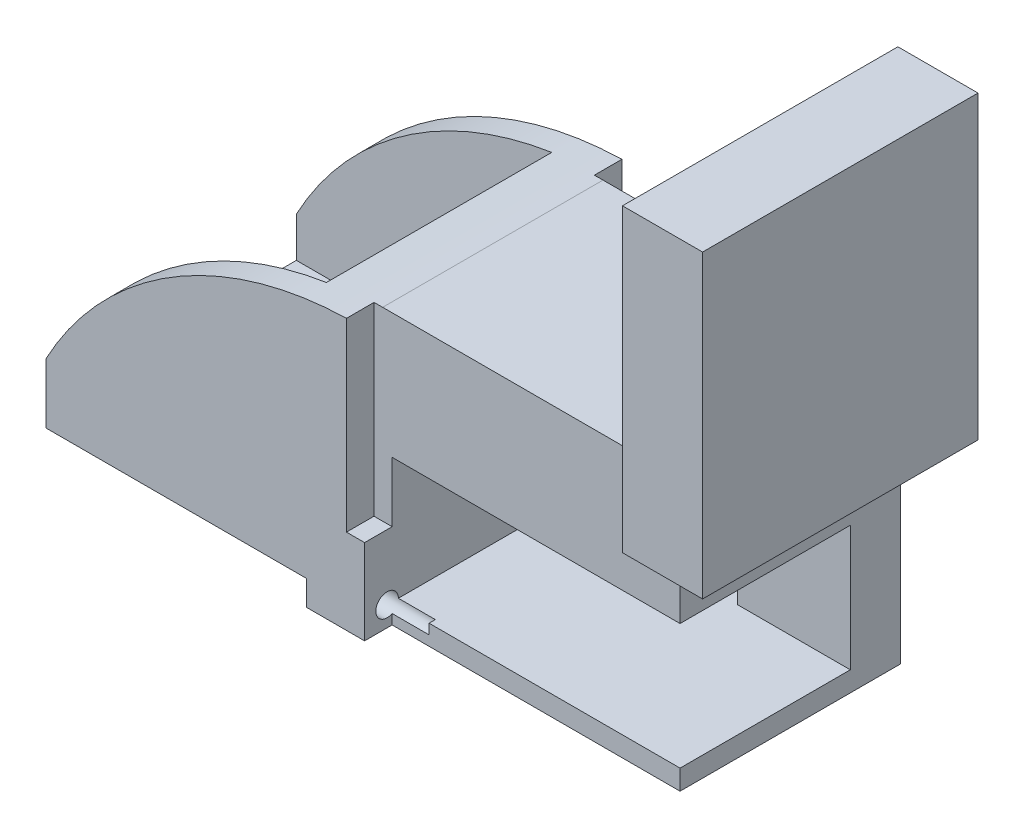
from build123d import *

# Parameters (mm, degrees)
SKETCH2_W                        = 30.56
SKETCH2_H                        = 22
BOSS_EXTRUDE1_DEPTH              = 27
SKETCH4_W                        = 28.75
SKETCH4_H                        = 12.5
CUT_EXTRUDE1_DEPTH               = 17
SKETCH5_W                        = 4
SKETCH5_H                        = 12.5
SKETCH5_H_2                      = 5
CUT_EXTRUDE2_DEPTH               = 39.032596546
SKETCH9_W                        = 27.5
SKETCH9_H                        = 18.5
BOSS_EXTRUDE2_DEPTH              = 30
FILLET1_R                        = 35
BOSS_EXTRUDE3_DEPTH              = 6
SKETCH10_6_W                     = 25.5
SKETCH10_6_H                     = 22.5
CUT_EXTRUDE3_DEPTH               = 51.80935839
SKETCH13_W                       = 22.5
SKETCH13_H                       = 2
BOSS_EXTRUDE4_DEPTH              = 25.5
SKETCH14_R                       = 3.5
CUT_EXTRUDE4_DEPTH               = 53.398386426
SKETCH20_W                       = 4
SKETCH20_H                       = 8.5
BOSS_EXTRUDE13_DEPTH             = 4
BOSS_EXTRUDE13_DIRECTION_2_REACH = 45.035
CUT_EXTRUDE5_START               = -4
SKETCH15_R                       = 1.125
CUT_EXTRUDE5_DEPTH               = 12
SKETCH21_W                       = 22
SKETCH21_H                       = 6.5
BOSS_EXTRUDE14_DEPTH             = 5
SKETCH22_W                       = 27.5
SKETCH22_H                       = 30
BOSS_EXTRUDE15_DEPTH             = 8


with BuildPart() as part:
    # Sketch2 → Boss-Extrude1 (new body)
    with BuildSketch(Plane(origin=(0, 0, 0), x_dir=(1, 0, 0), z_dir=(0, 1, 0))):
        Rectangle(SKETCH2_W, SKETCH2_H)
    extrude(amount=BOSS_EXTRUDE1_DEPTH)

    # Sketch4 → Cut-Extrude1 (cut)
    with BuildSketch(Plane.XY.offset(11)):
        with Locations((0.905, 8.25)):
            Rectangle(SKETCH4_W, SKETCH4_H)
    extrude(amount=-CUT_EXTRUDE1_DEPTH, mode=Mode.SUBTRACT)

    # Sketch5 → Cut-Extrude2 (cut, through all)
    with BuildSketch(Plane(origin=(0, 0, -11), x_dir=(-1, 0, 0), z_dir=(0, 0, -1))):
        with Locations((-2.03, 8.25)):
            Rectangle(SKETCH5_W, SKETCH5_H)
        with Locations((7.47, 7.5)):
            Rectangle(SKETCH5_W, SKETCH5_H_2)
    extrude(amount=-CUT_EXTRUDE2_DEPTH, mode=Mode.SUBTRACT)

    # Sketch9 → Boss-Extrude2 (add)
    with BuildSketch(Plane.ZY.offset(15.28)):
        with Locations((0, 17.75)):
            Rectangle(SKETCH9_W, SKETCH9_H)
    extrude(amount=BOSS_EXTRUDE2_DEPTH)

    # Fillet1
    # the kernel refuses this fillet: 35 mm, written as the material it takes off along each edge
    with BuildSketch(Plane(origin=(-45.28, 27, -90.91662167), x_dir=(1, 0, 0), z_dir=(0, 0, 1))) as fillet1_piece_1:
        with BuildLine():
            CenterArc((30.866648668, -35), FILLET1_R, 90, 61.872931781)
            Line((0, -18.5), (-0.617332973, -18.17))
            ThreePointArc((-0.617332973, -18.17), (-0.7, -9.25), (-0.7, 0))
            Line((-0.7, 0), (0, 0.7))
            Line((0, 0.7), (30.866648668, 0.7))
            Line((30.866648668, 0.7), (30.866648668, 0))
        make_face()
    extrude(amount=181.833243341, mode=Mode.SUBTRACT)

    # Sketch10 → Boss-Extrude3 (add)
    with BuildSketch(Plane.XZ.offset(-8.5)):
        Polygon((-45.28, 13.75), (-45.28, 11.25), (-19.78, 11.25), (-19.78, -11.25), (-45.28, -11.25), (-45.28, -13.75), (-17.78, -13.75), (-17.78, 13.75), align=None)
    extrude(amount=BOSS_EXTRUDE3_DEPTH)

    # Sketch10<6> → Cut-Extrude3 (cut, through all)
    with BuildSketch(Plane.XZ.offset(-8.5)):
        with Locations((-32.53, 0)):
            Rectangle(SKETCH10_6_W, SKETCH10_6_H)
    extrude(amount=-CUT_EXTRUDE3_DEPTH, mode=Mode.SUBTRACT)

    # Sketch13 → Boss-Extrude4 (add)
    with BuildSketch(Plane.ZY.offset(19.78)):
        with Locations((0, 3.5)):
            Rectangle(SKETCH13_W, SKETCH13_H)
    extrude(amount=BOSS_EXTRUDE4_DEPTH)

    # Sketch14 → Cut-Extrude4 (cut, through all)
    with BuildSketch(Plane(origin=(0, 4.5, 0), x_dir=(1, 0, 0), z_dir=(0, 1, 0))):
        with Locations(Location((-32.53, 0, 0), (0, 0, 270))):
            Circle(SKETCH14_R)
    extrude(amount=-CUT_EXTRUDE4_DEPTH, mode=Mode.SUBTRACT)

    # Sketch20 → Boss-Extrude13 (add)
    with BuildSketch(Plane.ZY.offset(15.28)):
        with Locations((11.75, 4.25)):
            Rectangle(SKETCH20_W, SKETCH20_H)
        with Locations((-11.75, 4.25)):
            Rectangle(SKETCH20_W, SKETCH20_H)
    extrude(amount=BOSS_EXTRUDE13_DEPTH)

    # Boss-Extrude13 direction 2: up to this face of the body (flat: up to its plane)
    boss_extrude13_direction_2_end = Plane(part.part.faces().sort_by_distance((-13.47, 8.25, 2.5))[0])
    # Sketch20 → Boss-Extrude13 direction 2 (add, up to the picked face)
    with BuildSketch(Plane.ZY.offset(15.28), mode=Mode.PRIVATE) as boss_extrude13_direction_2_sk1:
        with Locations((11.75, 4.25)):
            Rectangle(SKETCH20_W, SKETCH20_H)
    boss_extrude13_direction_2_tool1 = split(extrude(boss_extrude13_direction_2_sk1.sketch, amount=-BOSS_EXTRUDE13_DIRECTION_2_REACH, mode=Mode.PRIVATE), bisect_by=boss_extrude13_direction_2_end, keep=Keep.BOTH, mode=Mode.PRIVATE)
    # Sketch20 → Boss-Extrude13 direction 2 (add, up to the picked face)
    with BuildSketch(Plane.ZY.offset(15.28), mode=Mode.PRIVATE) as boss_extrude13_direction_2_sk2:
        with Locations((-11.75, 4.25)):
            Rectangle(SKETCH20_W, SKETCH20_H)
    boss_extrude13_direction_2_tool2 = split(extrude(boss_extrude13_direction_2_sk2.sketch, amount=-BOSS_EXTRUDE13_DIRECTION_2_REACH, mode=Mode.PRIVATE), bisect_by=boss_extrude13_direction_2_end, keep=Keep.BOTH, mode=Mode.PRIVATE)
    add(boss_extrude13_direction_2_tool1.solids().sort_by(Axis((-15.28, 4.25, 11.75), (1, 0, 0)))[0])
    add(boss_extrude13_direction_2_tool2.solids().sort_by(Axis((-15.28, 4.25, -11.75), (1, 0, 0)))[0])

    # Sketch15 → Cut-Extrude5 (cut)
    with BuildSketch(Plane(origin=(-17.78, 0, 0), x_dir=(0, 0, -1), z_dir=(1, 0, 0)).offset(CUT_EXTRUDE5_START)):
        with Locations(Location((-11.5, 2, 0), (0, 0, 153.612200039))):
            Circle(SKETCH15_R)
    cut_extrude5 = extrude(amount=CUT_EXTRUDE5_DEPTH, mode=Mode.SUBTRACT)

    # Mirror3: Cut-Extrude5 across plane
    add(cut_extrude5.mirror(Plane.XY), mode=Mode.SUBTRACT)

    # Sketch21 → Boss-Extrude14 (add)
    with BuildSketch(Plane(origin=(15.28, 0, 0), x_dir=(0, 0, -1), z_dir=(1, 0, 0))):
        with Locations((0, 23.75)):
            Rectangle(SKETCH21_W, SKETCH21_H)
    extrude(amount=BOSS_EXTRUDE14_DEPTH)

    # Sketch22 → Boss-Extrude15 (add)
    with BuildSketch(Plane(origin=(20.28, 0, 0), x_dir=(0, 0, -1), z_dir=(1, 0, 0))):
        with Locations((0, 35.5)):
            Rectangle(SKETCH22_W, SKETCH22_H)
    extrude(amount=-BOSS_EXTRUDE15_DEPTH)


solid = part.part
